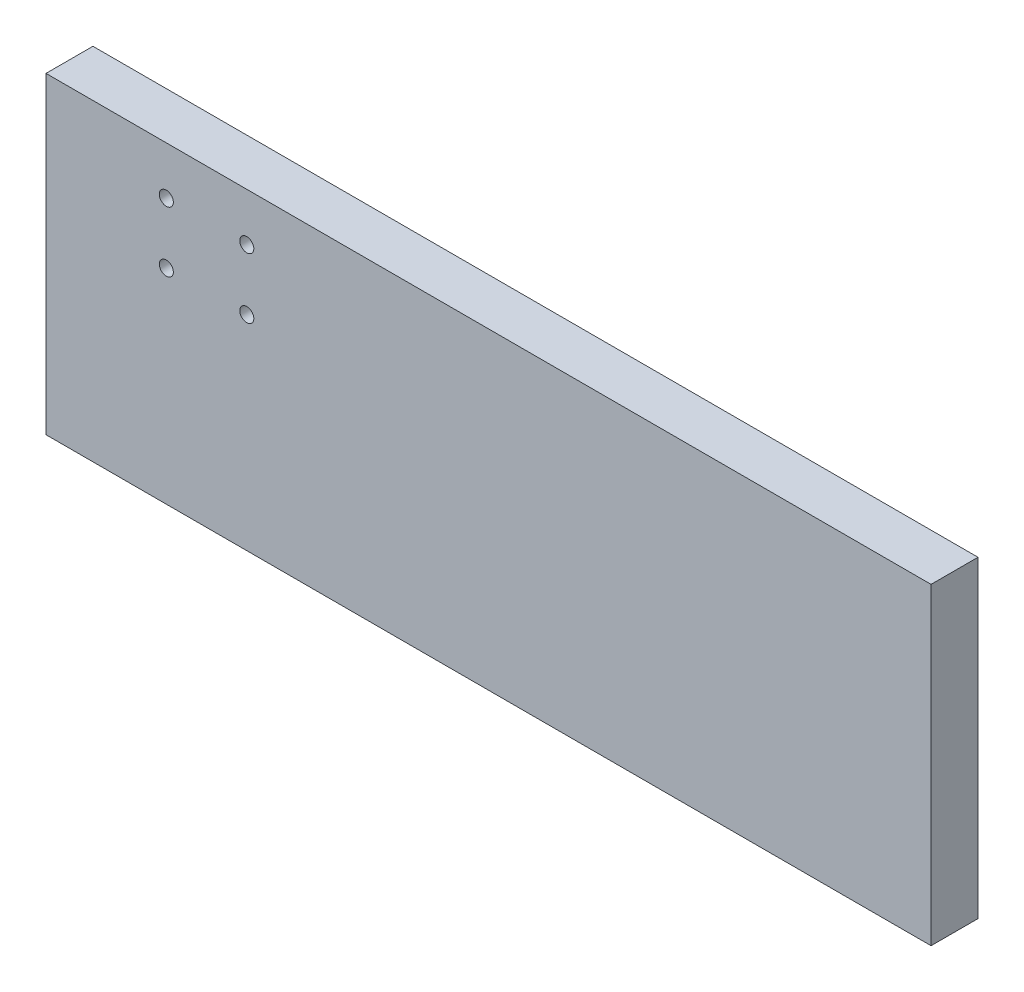
from build123d import *

# Parameters (mm, degrees)
SKETCH1_W           = 359.156
SKETCH1_H           = 127
BOSS_EXTRUDE1_DEPTH = 19.05
CUT_EXTRUDE1_REACH  = 383.425
SKETCH2_R           = 2.85115


with BuildPart() as part:
    # Sketch1 → Boss-Extrude1 (new body)
    with BuildSketch(Plane.XY):
        with Locations((179.578, 63.5)):
            Rectangle(SKETCH1_W, SKETCH1_H)
    extrude(amount=BOSS_EXTRUDE1_DEPTH)

    # Sketch2 → Cut-Extrude1 (cut, up to next)
    with BuildSketch(Plane.XY.offset(19.05), mode=Mode.PRIVATE) as cut_extrude1_sk1:
        with Locations((48.82515, 82.96275)):
            Circle(SKETCH2_R)
    cut_extrude1_tool1 = extrude(cut_extrude1_sk1.sketch, amount=-CUT_EXTRUDE1_REACH, mode=Mode.PRIVATE) & part.part
    # Sketch2 → Cut-Extrude1 (cut, up to next)
    with BuildSketch(Plane.XY.offset(19.05), mode=Mode.PRIVATE) as cut_extrude1_sk2:
        with Locations((48.82515, 107.53725)):
            Circle(SKETCH2_R)
    cut_extrude1_tool2 = extrude(cut_extrude1_sk2.sketch, amount=-CUT_EXTRUDE1_REACH, mode=Mode.PRIVATE) & part.part
    # Sketch2 → Cut-Extrude1 (cut, up to next)
    with BuildSketch(Plane.XY.offset(19.05), mode=Mode.PRIVATE) as cut_extrude1_sk3:
        with Locations((81.47685, 107.53725)):
            Circle(SKETCH2_R)
    cut_extrude1_tool3 = extrude(cut_extrude1_sk3.sketch, amount=-CUT_EXTRUDE1_REACH, mode=Mode.PRIVATE) & part.part
    # Sketch2 → Cut-Extrude1 (cut, up to next)
    with BuildSketch(Plane.XY.offset(19.05), mode=Mode.PRIVATE) as cut_extrude1_sk4:
        with Locations((81.47685, 82.96275)):
            Circle(SKETCH2_R)
    cut_extrude1_tool4 = extrude(cut_extrude1_sk4.sketch, amount=-CUT_EXTRUDE1_REACH, mode=Mode.PRIVATE) & part.part
    add(cut_extrude1_tool1.solids().sort_by_distance((48.82515, 82.96275, 19.05))[0], mode=Mode.SUBTRACT)
    add(cut_extrude1_tool2.solids().sort_by_distance((48.82515, 107.53725, 19.05))[0], mode=Mode.SUBTRACT)
    add(cut_extrude1_tool3.solids().sort_by_distance((81.47685, 107.53725, 19.05))[0], mode=Mode.SUBTRACT)
    add(cut_extrude1_tool4.solids().sort_by_distance((81.47685, 82.96275, 19.05))[0], mode=Mode.SUBTRACT)


solid = part.part
